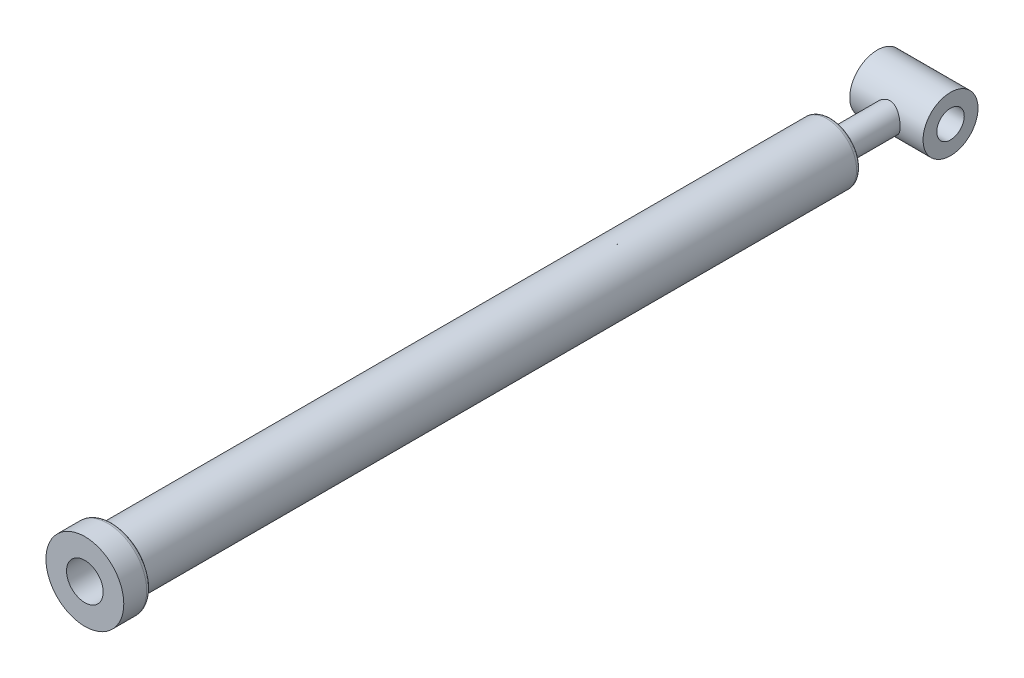
from build123d import *

# Parameters (mm, degrees)
SKETCH1_R           = 42.5
SKETCH1_R_2         = 20
BOSS_EXTRUDE1_DEPTH = 30
SKETCH2_R           = 32.5
SKETCH2_R_2         = 20
BOSS_EXTRUDE2_DEPTH = 780
SKETCH3_R           = 32.5
BOSS_EXTRUDE3_DEPTH = 5
SKETCH4_R           = 15
BOSS_EXTRUDE4_DEPTH = 65
SKETCH5_R           = 30
SKETCH5_R_2         = 15
BOSS_EXTRUDE5_DEPTH = 40
FILLET1_R           = 5


with BuildPart() as part:
    # Sketch1 → Boss-Extrude1 (new body)
    with BuildSketch(Plane.XY):
        Circle(SKETCH1_R)
        Circle(SKETCH1_R_2, mode=Mode.SUBTRACT)
    extrude(amount=-BOSS_EXTRUDE1_DEPTH)

    # Sketch2 → Boss-Extrude2 (add)
    with BuildSketch(Plane(origin=(0, 0, -30), x_dir=(-1, 0, 0), z_dir=(0, 0, -1))):
        with Locations(Location((0, 0, 0), (0, 0, 180))):
            Circle(SKETCH2_R)
        with Locations(Location((0, 0, 0), (0, 0, 180))):
            Circle(SKETCH2_R_2, mode=Mode.SUBTRACT)
    extrude(amount=BOSS_EXTRUDE2_DEPTH)

    # Sketch3 → Boss-Extrude3 (add)
    with BuildSketch(Plane(origin=(0, 0, -810), x_dir=(-1, 0, 0), z_dir=(0, 0, -1))):
        with Locations(Location((0, 0, 0), (0, 0, 180))):
            Circle(SKETCH3_R)
    extrude(amount=BOSS_EXTRUDE3_DEPTH)

    # Sketch4 → Boss-Extrude4 (add)
    with BuildSketch(Plane(origin=(0, 0, -815), x_dir=(-1, 0, 0), z_dir=(0, 0, -1))):
        Circle(SKETCH4_R)
    extrude(amount=BOSS_EXTRUDE4_DEPTH)

    # Sketch5 → Boss-Extrude5 (add, symmetric)
    with BuildSketch(Plane(origin=(0, 0, 0), x_dir=(0, 0, -1), z_dir=(1, 0, 0))):
        with Locations((905, 0)):
            Circle(SKETCH5_R)
        with Locations((905, 0)):
            Circle(SKETCH5_R_2, mode=Mode.SUBTRACT)
    extrude(amount=BOSS_EXTRUDE5_DEPTH, both=True)

    # Fillet1
    fillet1_edges = [part.edges().sort_by_distance(p)[0] for p in [
        (-32.5, 0, -30),
        (-32.5, 0, -815),
        (15, 0, -815),
        (-42.5, 0, -30),
    ]]
    fillet(fillet1_edges, radius=FILLET1_R - 0.0001)  # a hair under: the kernel refuses the full size


solid = part.part
